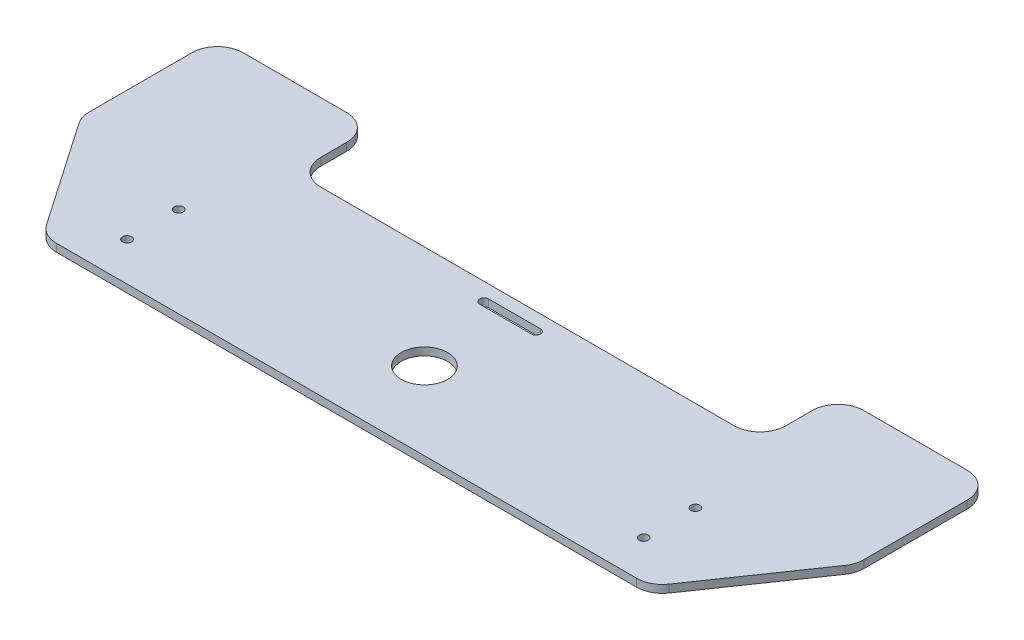
from build123d import *

# Parameters (mm, degrees)
EXTRUDE_1_DEPTH     = 3
SKETCH_2_R          = 1.75
CUT_EXTRUDE_1_DEPTH = 10
CUT_EXTRUDE_2_DEPTH = 3
SKETCH_4_R          = 9
CUT_EXTRUDE_3_DEPTH = 10


with BuildPart() as part:
    # 草图1 → 凸台-拉伸1 (new body)
    with BuildSketch(Plane(origin=(0, 0, 0), x_dir=(1, 0, 0), z_dir=(0, 1, 0))):
        with BuildLine():
            Line((-148.235829522, 19.513411872), (-120.492131082, -20.771152042))
            ThreePointArc((-120.492131082, -20.771152042), (-116.908205257, -23.951300285), (-112.25630156, -25.099193643))
            Line((-112.25630156, -25.099193643), (112.25630156, -25.099193643))
            ThreePointArc((112.25630156, -25.099193643), (116.908205257, -23.951300285), (120.492131082, -20.771152042))
            Line((120.492131082, -20.771152042), (148.235829522, 19.513411872))
            ThreePointArc((148.235829522, 19.513411872), (149.548777283, 22.215378286), (150, 25.185370271))
            Line((150, 25.185370271), (150, 65))
            ThreePointArc((150, 65), (147.169490918, 72.124628896), (140.101052961, 75.092675968))
            Line((140.101052961, 75.092675968), (100.001859318, 75.092675968))
            ThreePointArc((100.001859318, 75.092675968), (92.860872953, 72.096900105), (90, 64.900806357))
            Line((90, 64.900806357), (90, 54.900806357))
            ThreePointArc((90, 54.900806357), (87.071067812, 47.829738545), (80, 44.900806357))
            Line((80, 44.900806357), (-80, 44.900806357))
            ThreePointArc((-80, 44.900806357), (-87.071067812, 47.829738545), (-90, 54.900806357))
            Line((-90, 54.900806357), (-90, 64.900806357))
            ThreePointArc((-90, 64.900806357), (-92.928932188, 71.971874169), (-100, 74.900806357))
            Line((-100, 74.900806357), (-140.099193643, 74.900806357))
            ThreePointArc((-140.099193643, 74.900806357), (-147.100120957, 72.000927314), (-150, 65))
            Line((-150, 65), (-150, 25.185370271))
            ThreePointArc((-150, 25.185370271), (-149.548777283, 22.215378286), (-148.235829522, 19.513411872))
        make_face()
    extrude(amount=EXTRUDE_1_DEPTH)

    # 草图2 → 切除-拉伸1 (cut)
    with BuildSketch(Plane(origin=(0, 3, 0), x_dir=(1, 0, 0), z_dir=(0, 1, 0))):
        with Locations((100, 9.900806357)):
            Circle(SKETCH_2_R)
        with Locations((100, -10.099193643)):
            Circle(SKETCH_2_R)
        with Locations((-100, -10.099193643)):
            Circle(SKETCH_2_R)
        with Locations((-100, 9.900806357)):
            Circle(SKETCH_2_R)
    extrude(amount=-CUT_EXTRUDE_1_DEPTH, mode=Mode.SUBTRACT)

    # 草图3 → 切除-拉伸2 (cut)
    with BuildSketch(Plane(origin=(0, 3, 0), x_dir=(1, 0, 0), z_dir=(0, 1, 0))):
        with BuildLine():
            Line((-10, 39.900806357), (10, 39.900806357))
            ThreePointArc((10, 39.900806357), (11.75, 38.150806357), (10, 36.400806357))
            Line((10, 36.400806357), (-10, 36.400806357))
            ThreePointArc((-10, 36.400806357), (-11.75, 38.150806357), (-10, 39.900806357))
        make_face()
    extrude(amount=-CUT_EXTRUDE_2_DEPTH, mode=Mode.SUBTRACT)

    # 草图4 → 切除-拉伸3 (cut)
    with BuildSketch(Plane(origin=(0, 3, 0), x_dir=(1, 0, 0), z_dir=(0, 1, 0))):
        with Locations((0, 5)):
            Circle(SKETCH_4_R)
    extrude(amount=-CUT_EXTRUDE_3_DEPTH, mode=Mode.SUBTRACT)


solid = part.part
